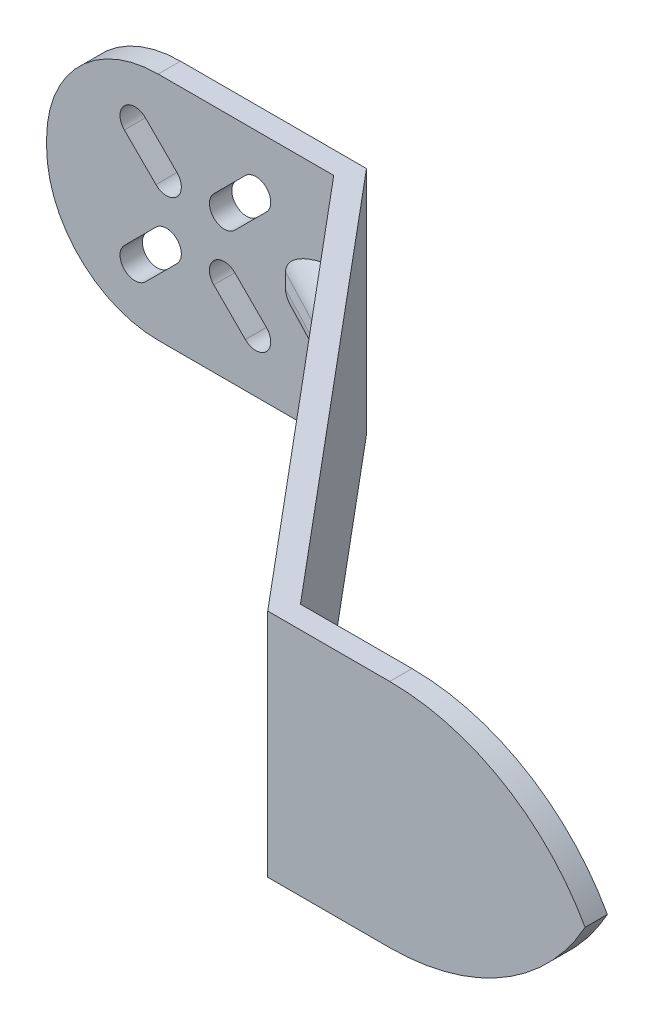
from build123d import *

# Parameters (mm, degrees)
SALIENTE_EXTRUIR2_DEPTH = 31
CORTAR_EXTRUIR1_DEPTH   = 10
REDONDEO4_R             = 15
REDONDEO7_R             = 30
SALIENTE_EXTRUIR3_DEPTH = 5
REDONDEO8_R             = 4
REDONDEO9_R             = 4
REDONDEO11_R            = 4


with BuildPart() as part:
    # Croquis2 → Saliente-Extruir2 (new body)
    with BuildSketch(Plane(origin=(0, 0, 0), x_dir=(1, 0, 0), z_dir=(0, 1, 0))):
        Polygon((-84.881784923, 58.155199905), (-84.881784923, 55.155199905), (-46.280707897, 55.155199905), (0, 0), (46.398922974, 0), (46.398922974, 3), (1.398922974, 3), (-44.881784923, 58.155199905), align=None)
    extrude(amount=SALIENTE_EXTRUIR2_DEPTH)

    # Croquis3 → Cortar-Extruir1 (cut)
    with BuildSketch(Plane(origin=(0, 0, -58.155199905), x_dir=(-1, 0, 0), z_dir=(0, 0, -1))):
        with BuildLine():
            Line((58.164270502, 25.045941546), (62.406911189, 20.803300859))
            ThreePointArc((62.406911189, 20.803300859), (62.406911189, 17.974873734), (59.578484064, 17.974873734))
            Line((59.578484064, 17.974873734), (55.335843377, 22.217514421))
            ThreePointArc((55.335843377, 22.217514421), (55.335843377, 25.045941546), (58.164270502, 25.045941546))
        make_face()
        with BuildLine():
            Line((71.599299344, 5.954058454), (67.356658657, 10.196699141))
            ThreePointArc((67.356658657, 10.196699141), (67.356658657, 13.025126266), (70.185085782, 13.025126266))
            Line((70.185085782, 13.025126266), (74.427726469, 8.782485579))
            ThreePointArc((74.427726469, 8.782485579), (74.427726469, 5.954058454), (71.599299344, 5.954058454))
        make_face()
        with BuildLine():
            Line((74.427726469, 22.217514421), (70.185085782, 17.974873734))
            ThreePointArc((70.185085782, 17.974873734), (67.356658657, 17.974873734), (67.356658657, 20.803300859))
            Line((67.356658657, 20.803300859), (71.599299344, 25.045941546))
            ThreePointArc((71.599299344, 25.045941546), (74.427726469, 25.045941546), (74.427726469, 22.217514421))
        make_face()
        with BuildLine():
            Line((55.335843377, 8.782485579), (59.578484064, 13.025126266))
            ThreePointArc((59.578484064, 13.025126266), (62.406911189, 13.025126266), (62.406911189, 10.196699141))
            Line((62.406911189, 10.196699141), (58.164270502, 5.954058454))
            ThreePointArc((58.164270502, 5.954058454), (55.335843377, 5.954058454), (55.335843377, 8.782485579))
        make_face()
    extrude(amount=-CORTAR_EXTRUIR1_DEPTH, mode=Mode.SUBTRACT)

    # Redondeo4
    redondeo4_edges = [part.edges().sort_by_distance(p)[0] for p in [
        (-84.881784923, 0, -56.655199905),
        (-84.881784923, 31, -56.655199905),
    ]]
    fillet(redondeo4_edges, radius=REDONDEO4_R)

    # Redondeo7
    # the kernel refuses this fillet: 30 mm, written as the material it takes off along each edge
    with BuildSketch(Plane(origin=(46.398922974, 0, 75), x_dir=(-1, 0, 0), z_dir=(0, 0, -1))) as redondeo7_piece_1:
        with BuildLine():
            CenterArc((REDONDEO7_R, REDONDEO7_R), REDONDEO7_R, 180, 90)
            Line((0, REDONDEO7_R), (0, 0))
            Line((0, 0), (REDONDEO7_R, 0))
        make_face()
    extrude(amount=153, mode=Mode.SUBTRACT)
    with BuildSketch(Plane(origin=(46.398922974, 31, 75), x_dir=(-1, 0, 0), z_dir=(0, 0, -1))) as redondeo7_piece_2:
        with BuildLine():
            CenterArc((REDONDEO7_R, -REDONDEO7_R), REDONDEO7_R, 90, 90)
            Line((0, -REDONDEO7_R), (0, 0))
            Line((0, 0), (REDONDEO7_R, 0))
        make_face()
    extrude(amount=153, mode=Mode.SUBTRACT)

    # Croquis4 → Saliente-Extruir3 (add, symmetric)
    with BuildSketch(Plane(origin=(0, 15.5, 0), x_dir=(1, 0, 0), z_dir=(0, 1, 0))):
        Polygon((-8.108577144, 14.330597423), (16.398922974, 3), (1.398922974, 3), align=None)
        Polygon((-52.760428047, 55.155199905), (-41.234854299, 49.141785751), (-46.280707897, 55.155199905), align=None)
    extrude(amount=SALIENTE_EXTRUIR3_DEPTH, both=True)

    # Redondeo8
    redondeo8_edges = [part.edges().sort_by_distance(p)[0] for p in [
        (4.145172915, 20.5, -8.665298711),
    ]]
    fillet(redondeo8_edges, radius=REDONDEO8_R)

    # Redondeo9
    redondeo9_edges = [part.edges().sort_by_distance(p)[0] for p in [
        (4.145172915, 10.5, -8.665298711),
    ]]
    fillet(redondeo9_edges, radius=REDONDEO9_R)

    # Redondeo11
    # the kernel refuses this fillet: 4 mm, written as the material it takes off along each edge
    with BuildSketch(Plane(origin=(-61.626254007, 10.5, -59.780903099), x_dir=(0, 1, 0), z_dir=(0.886582596003956, 0, 0.4625703194789808))) as redondeo11_piece_1_section:
        with BuildLine():
            CenterArc((REDONDEO11_R, -REDONDEO11_R), REDONDEO11_R, 90, 90)
            Line((0, -REDONDEO11_R), (0, 0))
            Line((0, 0), (REDONDEO11_R, 0))
        make_face()
    redondeo11_piece_1 = extrude(amount=33, mode=Mode.PRIVATE)
    redondeo11_piece_1 = split(redondeo11_piece_1, bisect_by=Plane(origin=(-45.320912512, 11.608841442, -54.011360305), z_dir=(-0.7660444431189792, 0, 0.642787609686538)), keep=Keep.TOP, mode=Mode.PRIVATE)
    redondeo11_piece_1 = split(redondeo11_piece_1, bisect_by=Plane(origin=(-46.861736651, 11.608841442, -55.155199905), z_dir=(0, 0, 1)), keep=Keep.TOP, mode=Mode.PRIVATE)
    add(redondeo11_piece_1, mode=Mode.SUBTRACT)
    with BuildSketch(Plane(origin=(-61.626254007, 20.5, -59.780903099), x_dir=(0.4625703194789808, 0, -0.886582596003956), z_dir=(0.886582596003956, 0, 0.4625703194789808))) as redondeo11_piece_2_section:
        with BuildLine():
            CenterArc((REDONDEO11_R, -REDONDEO11_R), REDONDEO11_R, 90, 90)
            Line((0, -REDONDEO11_R), (0, 0))
            Line((0, 0), (REDONDEO11_R, 0))
        make_face()
    redondeo11_piece_2 = extrude(amount=33, mode=Mode.PRIVATE)
    redondeo11_piece_2 = split(redondeo11_piece_2, bisect_by=Plane(origin=(-45.320912512, 19.391158558, -54.011360306), z_dir=(-0.7660444431189792, 0, 0.642787609686538)), keep=Keep.TOP, mode=Mode.PRIVATE)
    redondeo11_piece_2 = split(redondeo11_piece_2, bisect_by=Plane(origin=(-46.861736651, 19.391158558, -55.155199905), z_dir=(0, 0, 1)), keep=Keep.TOP, mode=Mode.PRIVATE)
    add(redondeo11_piece_2, mode=Mode.SUBTRACT)


solid = part.part
